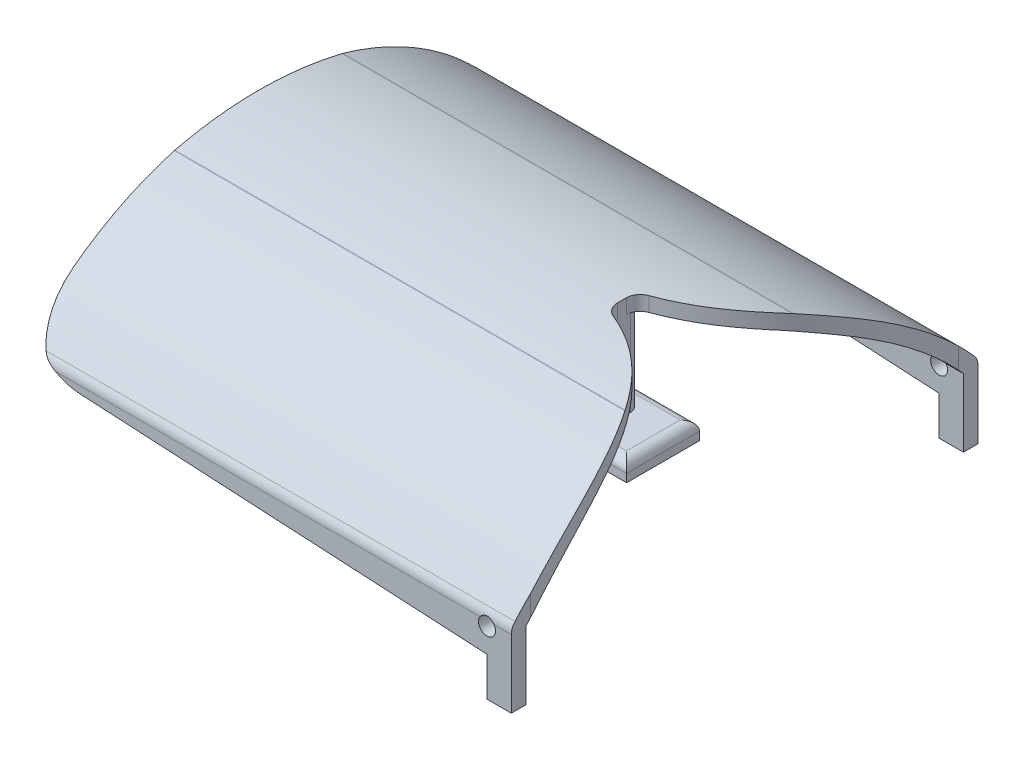
from build123d import *

# Parameters (mm, degrees)
EXTRUDE_THIN1_DEPTH = 100
CUT_EXTRUDE2_DEPTH  = 33.5
FILLET1_R           = 3
SKETCH6_W           = 108.67085681690114
SKETCH6_H           = 17.87977423217149
CUT_EXTRUDE3_DEPTH  = 166
BOSS_EXTRUDE1_DEPTH = 10.5
CUT_EXTRUDE4_DEPTH  = 27.00000000000001
SKETCH11_R          = 1.749999999999997
CUT_EXTRUDE5_DEPTH  = 5
BOSS_EXTRUDE2_DEPTH = 7.500000000000001
CUT_EXTRUDE6_START  = -15.000000000000002
CUT_EXTRUDE6_DEPTH  = 15.000000000000002
FILLET3_R           = 2
CUT_EXTRUDE7_DEPTH  = 5.000000000000001
FILLET5_R           = 12


with BuildPart() as part:
    # Sketch1 → Extrude-Thin1 (new body)
    with BuildSketch(Plane(origin=(0, 0, 0), x_dir=(0, 0, -1), z_dir=(1, 0, 0))):
        with BuildLine():
            Line((44.99999999999999, -32), (45, -18.000000000000004))
            ThreePointArc((45, -18.000000000000004), (32.040658090715816, -6.957616725901104), (16.501342127994352, -3.94e-15))
            ThreePointArc((16.501342127994352, -3.94e-15), (-9.68e-15, 1.9727576042150758), (-16.501342127994352, 2.58e-15))
            ThreePointArc((-16.501342127994352, 2.58e-15), (-32.040658090715816, -6.957616725901083), (-45, -17.99999999999999))
            Line((-45, -17.99999999999999), (-45.00000000000001, -31.999999999999986))
            Line((-45.00000000000001, -31.999999999999986), (-48.00000000000001, -31.999999999999986))
            Line((-48.00000000000001, -31.999999999999986), (-48, -16.881858139762553))
            ThreePointArc((-48, -16.881858139762553), (-34.09998293164343, -4.712774745757805), (-17.2676846598946, 2.901081047578947))
            ThreePointArc((-17.2676846598946, 2.901081047578947), (-9.055e-14, 4.972757604215076), (17.26768465989443, 2.901081047578978))
            ThreePointArc((17.26768465989443, 2.901081047578978), (34.099982931643346, -4.71277474575777), (48, -16.881858139762553))
            Line((48, -16.881858139762553), (47.99999999999999, -32))
            Line((47.99999999999999, -32), (44.99999999999999, -32))
        make_face()
    extrude(amount=EXTRUDE_THIN1_DEPTH)

    # Sketch5 → Cut-Extrude2 (cut, symmetric)
    with BuildSketch(Plane(origin=(0, 0, 0), x_dir=(1, 0, 0), z_dir=(0, 1, 0))):
        with BuildLine():
            Line((74.78082212000585, 2.9999999999999996), (74.78082212000585, -3.0000000000000004))
            add(Edge.make_bspline(
                [(74.78082212000585, -3.0000000000000004), (97.6340902919286, -10.562952056895462), (100, -44)],
                knots=[0, 0, 0, 1, 1, 1], degree=2))
            Line((100, -44), (100, 44))
            add(Edge.make_bspline(
                [(74.78082212000585, 2.9999999999999996), (97.6340902919286, 10.562952056895462), (100, 44)],
                knots=[0, 0, 0, 1, 1, 1], degree=2))
        make_face()
    extrude(amount=CUT_EXTRUDE2_DEPTH, both=True, mode=Mode.SUBTRACT)

    # Fillet1
    fillet1_edges = [part.edges().sort_by_distance(p)[0] for p in [
        (50, -16.881858139762556, -48),
        (50, -16.88185813976255, 48),
        (74.78082212000585, 3.4097650316477264, 3.0000000000000004),
        (74.78082212000585, 3.4097650316477246, -2.9999999999999996),
        (46.32817175668929, 2.9010810475789732, -17.267684659894428),
        (46.328171756689336, 2.9010810475789484, 17.267684659894588),
    ]]
    fillet(fillet1_edges, radius=FILLET1_R)

    # Sketch6 → Cut-Extrude3 (cut)
    with BuildSketch(Plane(origin=(0, -2.379e-14, -48.00000000000001), x_dir=(-1, 0, 0), z_dir=(0, -5e-16, -1))):
        with Locations((-40.66457159154943, -32.93988711608573)):
            Rectangle(SKETCH6_W, SKETCH6_H)
    extrude(amount=-CUT_EXTRUDE3_DEPTH, mode=Mode.SUBTRACT)

    # Sketch8 → Boss-Extrude1 (add, symmetric)
    with BuildSketch(Plane.XY):
        Polygon((0, 1.9727576042150723), (-2.8489105039621805, -17.99999999999999), (7.1510894960378195, -17.99999999999999), (15, 1.972757604215074), align=None)
    extrude(amount=BOSS_EXTRUDE1_DEPTH, both=True)

    # Sketch10 → Cut-Extrude4 (cut)
    with BuildSketch(Plane.XY.offset(10.5)):
        with BuildLine():
            Line((-0.3489105039621806, -17.99999999999999), (3.9871579959635945, -17.99999999999999))
            ThreePointArc((3.9871579959635945, -17.99999999999999), (1.8191237460007066, -14.255159652410038), (-0.3489105039621806, -17.99999999999999))
        make_face()
    extrude(amount=-CUT_EXTRUDE4_DEPTH, mode=Mode.SUBTRACT)

    # Sketch11 → Cut-Extrude5 (cut)
    with BuildSketch(Plane(origin=(0, -2.379e-14, -48.00000000000001), x_dir=(-1, 0, 0), z_dir=(0, -5e-16, -1))):
        with Locations(Location((-95, -18.99999999999998, 0), (0, 0, 34.849904579))):
            Circle(SKETCH11_R)
    cut_extrude5 = extrude(amount=-CUT_EXTRUDE5_DEPTH, mode=Mode.SUBTRACT)

    # Mirror1: Cut-Extrude5 across plane
    add(cut_extrude5.mirror(Plane.XY), mode=Mode.SUBTRACT)

    # Sketch12 → Boss-Extrude2 (add, symmetric)
    with BuildSketch(Plane.XY):
        Polygon((74.78082212000585, 1.9727576042150723), (74.78082212000585, -15.901753636370586), (83.21987044067507, -15.901753636370586), (83.21987044067507, -19.589110757152636), (67.6773818593807, -19.589110757152636), (67.6773818593807, 1.9727576042150723), align=None)
    extrude(amount=BOSS_EXTRUDE2_DEPTH, both=True)

    # Sketch13 → Cut-Extrude6 (cut)
    with BuildSketch(Plane(origin=(74.78082212000585, 0, 0), x_dir=(0, 0, -1), z_dir=(1, 0, 0)).offset(CUT_EXTRUDE6_START)):
        with BuildLine():
            Line((-7.500000000000001, 1.569812139590343), (-7.499999999999999, -15.901753636370586))
            Line((-7.499999999999999, -15.901753636370586), (-3.7049771024193907, -15.901753636370586))
            Line((-3.7049771024193907, -15.901753636370586), (-3.7049771024193907, 1.8746398726529334))
            ThreePointArc((-3.7049771024193907, 1.8746398726529334), (-5.604561352429517, 1.748031821138369), (-7.500000000000001, 1.569812139590343))
        make_face()
        with BuildLine():
            Line((7.499999999999999, -15.901753636370586), (3.7049771024193907, -15.901753636370586))
            Line((3.7049771024193907, -15.901753636370586), (3.7049771024193907, 1.8746398726529334))
            ThreePointArc((3.7049771024193907, 1.8746398726529334), (5.6045613524295295, 1.7480318211384258), (7.500000000000001, 1.569812139590343))
            Line((7.500000000000001, 1.569812139590343), (7.499999999999999, -15.901753636370586))
        make_face()
    extrude(amount=CUT_EXTRUDE6_DEPTH, mode=Mode.SUBTRACT)

    # Fillet3
    fillet3_edges = [part.edges().sort_by_distance(p)[0] for p in [
        (75.44862615002788, -15.901753636370586, -7.5),
        (83.21987044067507, -15.901753636370586, 0),
        (75.44862615002788, -15.901753636370586, 7.5),
        (67.6773818593807, -7.013556881858825, -3.7049771024193907),
        (67.6773818593807, -7.013556881858825, 3.7049771024193907),
        (74.78082212000585, -7.013556881858825, 3.7049771024193907),
        (74.78082212000585, -7.013556881858825, -3.7049771024193907),
    ]]
    fillet(fillet3_edges, radius=FILLET3_R)

    # Sketch15 → Cut-Extrude7 (cut)
    with BuildSketch(Plane(origin=(0, -2.379e-14, -48.00000000000001), x_dir=(-1, 0, 0), z_dir=(0, -5e-16, -1))):
        Polygon((-95, -23.99999999999998), (0, -18.860125054588586), (0, -26.572046869734645), align=None)
    cut_extrude7 = extrude(amount=-CUT_EXTRUDE7_DEPTH, mode=Mode.SUBTRACT)

    # Mirror2: Cut-Extrude7 across plane
    add(cut_extrude7.mirror(Plane.XY), mode=Mode.SUBTRACT)

    # Fillet5
    # the kernel refuses this fillet: 12 mm, written as the material it takes off along each edge
    with BuildSketch(Plane(origin=(0, -18.860125054588625, 76.42075806632201), x_dir=(0, 1, 5e-16), z_dir=(0, 5e-16, -1))) as fillet5_piece_1:
        with BuildLine():
            CenterArc((FILLET5_R * 0.947358602211, FILLET5_R), FILLET5_R, 183.09690836649892, 86.90309163350105)
            Line((-FILLET5_R * 0.0511809847104, FILLET5_R * 0.945975067318), (0, 0))
            Line((0, 0), (FILLET5_R * 0.947358602211, 0))
        make_face()
    extrude(amount=59.841516132644024, mode=Mode.SUBTRACT)
    with BuildSketch(Plane(origin=(0, -18.860125054588625, -76.42075806632201), x_dir=(0, 1, -5e-16), z_dir=(0, 5e-16, 1))) as fillet5_piece_2:
        with BuildLine():
            CenterArc((FILLET5_R * 0.947358602211, -FILLET5_R), FILLET5_R, 90, 86.90309163350108)
            Line((-FILLET5_R * 0.0511809847104, -FILLET5_R * 0.945975067318), (0, 0))
            Line((0, 0), (FILLET5_R * 0.947358602211, 0))
        make_face()
    extrude(amount=59.841516132644024, mode=Mode.SUBTRACT)


solid = part.part
